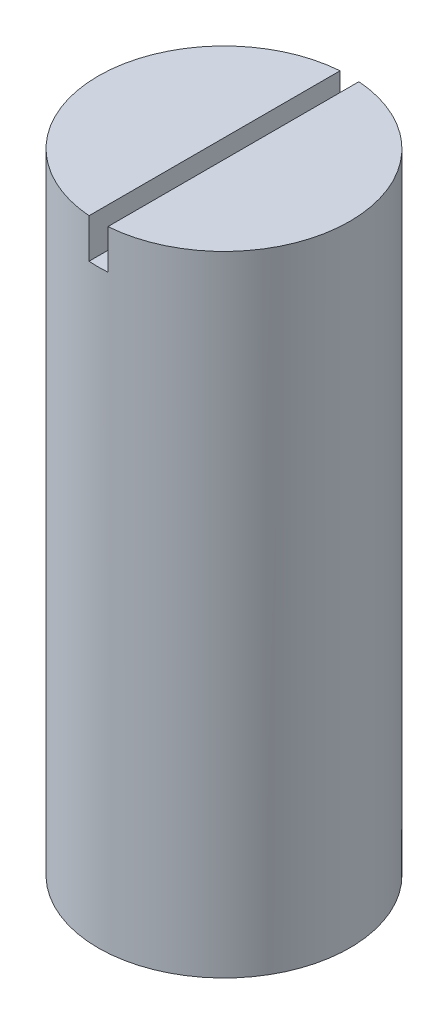
from build123d import *

# Parameters (mm, degrees)
SKETCH1_R           = 16
BOSS_EXTRUDE1_DEPTH = 80
SKETCH2_W           = 2.4
SKETCH2_H           = 7.016
CUT_EXTRUDE1_DEPTH  = 18


with BuildPart() as part:
    # Sketch1 → Boss-Extrude1 (new body)
    with BuildSketch(Plane(origin=(0, 0, 0), x_dir=(1, 0, 0), z_dir=(0, 1, 0))):
        Circle(SKETCH1_R)
    extrude(amount=BOSS_EXTRUDE1_DEPTH)

    # Sketch2 → Cut-Extrude1 (cut, symmetric)
    with BuildSketch(Plane.XY):
        with Locations((0, 78.492)):
            Rectangle(SKETCH2_W, SKETCH2_H)
    extrude(amount=CUT_EXTRUDE1_DEPTH, both=True, mode=Mode.SUBTRACT)


solid = part.part
